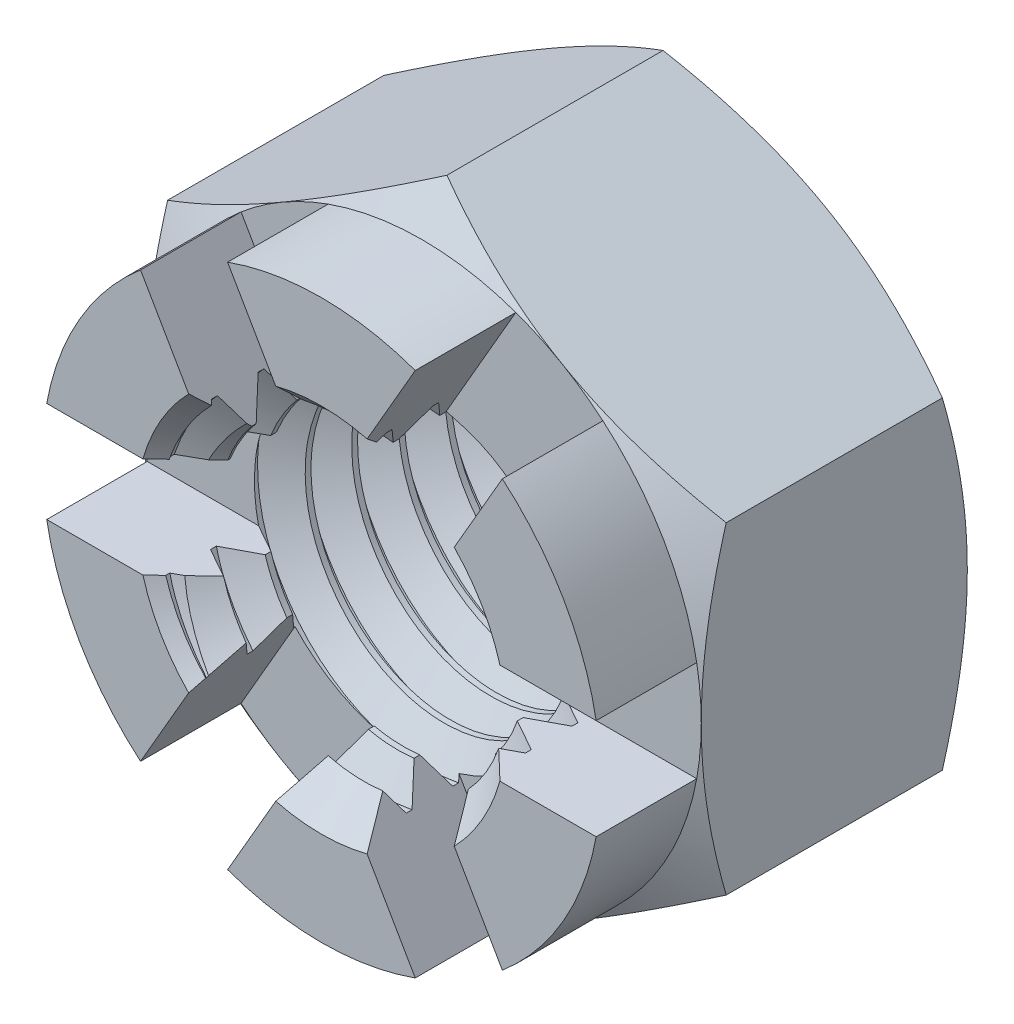
from build123d import *

# Parameters (mm, degrees)
EXTRUDE1_DEPTH      = 8.334375
SKETCH3_OUTSIDE_W   = 66.688
SKETCH3_OUTSIDE_H   = 68.652
SKETCH3_OUTSIDE_R   = 6.35
CUT_EXTRUDE2_DEPTH  = 13.788574587
CUT_EXTRUDE2_DRAFT  = -60
SKETCH4_R           = 3.9624
CUT_EXTRUDE3_DEPTH  = 13.788574587
SKETCH12_R          = 3.9624
SKETCH12_R_2        = 3.274992336
EXTRUDE2_DEPTH      = 8.334375
CUT_SWEEP1_PITCH    = 1.058333333
CUT_EXTRUDE8_DEPTH  = 2.286
SKETCH14_OUTSIDE_W  = 61.986
SKETCH14_OUTSIDE_H  = 63.95
SKETCH14_OUTSIDE_R  = 6.35
CUT_EXTRUDE9_DEPTH  = 12.431039965
CUT_EXTRUDE9_DRAFT  = -60
SKETCH15_OUTSIDE_W  = 18.922
SKETCH15_OUTSIDE_H  = 20.886
SKETCH15_OUTSIDE_R  = 6.35
CUT_EXTRUDE10_DEPTH = 2.286
CIRPATTERN1_COUNT   = 6


with BuildPart() as part:
    # Sketch1 → Extrude1 (new body)
    with BuildSketch(Plane.XY):
        Polygon((0, 7.332348419), (-6.35, 3.666174209), (-6.35, -3.666174209), (0, -7.332348419), (6.35, -3.666174209), (6.35, 3.666174209), align=None)
    extrude(amount=-EXTRUDE1_DEPTH)


with BuildPart() as cut_extrude2_tool:
    # Sketch3 outside → Cut-Extrude2 (with draft: the straight prism first)
    with BuildSketch(Plane(origin=(0, 0, -8.334375), x_dir=(-1, 0, 0), z_dir=(0, 0, -1))):
        Rectangle(SKETCH3_OUTSIDE_W, SKETCH3_OUTSIDE_H)
        Circle(SKETCH3_OUTSIDE_R, mode=Mode.SUBTRACT)
    extrude(amount=-CUT_EXTRUDE2_DEPTH)
    # Cut-Extrude2: the draft: its side faces are tilted about the plane it starts from
    cut_extrude2_sides = [cut_extrude2_tool.faces().sort_by_distance(p)[0] for p in [
        (0, -34.326, -1.440087706),
        (-33.344, 0, -1.440087706),
        (0, 34.326, -1.440087706),
        (33.344, 0, -1.440087706),
        (6.35, 0, -1.440087706),
    ]]
    draft(cut_extrude2_sides, Plane(origin=(0, 0, -8.334375), x_dir=(-1, 0, 0), z_dir=(0, 0, -1)), CUT_EXTRUDE2_DRAFT)


with BuildPart() as part_1:
    add(part.part)

    # Cut-Extrude2: cut by cut_extrude2_tool
    add(cut_extrude2_tool.part, mode=Mode.SUBTRACT)

    # Sketch4 → Cut-Extrude3 (cut, through all)
    with BuildSketch(Plane.XY):
        Circle(SKETCH4_R)
    extrude(amount=-CUT_EXTRUDE3_DEPTH, mode=Mode.SUBTRACT)

    # Sketch12 → Extrude2 (add)
    with BuildSketch(Plane.XY):
        Circle(SKETCH12_R)
        Circle(SKETCH12_R_2, mode=Mode.SUBTRACT)
    extrude(amount=-EXTRUDE2_DEPTH)

    # Cut-Sweep1: the profile of Sketch9 profile screwed along a right-hand helix of 8.875 turns, 6 arcs to a turn; built about Z, then put on its axis
    cut_sweep1_z = Axis((0, 0, 0), (0, 0, 1))
    cut_sweep1_corners = [(3.9624, 0, -0.529166667), (3.9624, 0, -0.396875), (3.274692336, 0, 0.000173205), (3.274692336, 0, -0.926214872)]
    with BuildLine(mode=Mode.PRIVATE) as cut_sweep1_profile:
        Line(cut_sweep1_corners[0], cut_sweep1_corners[1])
        Line(cut_sweep1_corners[1], cut_sweep1_corners[2])
        Line(cut_sweep1_corners[2], cut_sweep1_corners[3])
        Line(cut_sweep1_corners[3], cut_sweep1_corners[0])
    cut_sweep1_cap = Face(cut_sweep1_profile.wire())
    cut_sweep1_turn_angles = [0, 30, 60, 90, 120, 150, 180, 210, 240, 270, 300, 330, 360]
    cut_sweep1_turn_weights = [1, 0.8660254037844387, 1, 0.8660254037844387, 1, 0.8660254037844387, 1, 0.8660254037844387, 1, 0.8660254037844387, 1, 0.8660254037844387, 1]
    cut_sweep1_turn_rails = [Edge.make_bspline([Vector(p[0], p[1], 0).rotate(cut_sweep1_z, cut_sweep1_turn_angles[k]) / cut_sweep1_turn_weights[k] + Vector(0, 0, p[2] + CUT_SWEEP1_PITCH * cut_sweep1_turn_angles[k] / 360) for k in range(13)], [0, 0, 0, 1, 1, 2, 2, 3, 3, 4, 4, 5, 5, 6, 6, 6], 2, cut_sweep1_turn_weights) for p in cut_sweep1_corners]
    cut_sweep1_turn_sides = [Face.make_surface_from_curves(cut_sweep1_turn_rails[p[0]], cut_sweep1_turn_rails[p[1]]) for p in [(0, 1), (1, 2), (2, 3), (3, 0)]]
    cut_sweep1_last_angles = [2880, 2910, 2940, 2970, 3000, 3030, 3060, 3090, 3120, 3150, 3180, 3187.5, 3195]
    cut_sweep1_last_weights = [1, 0.8660254037844387, 1, 0.8660254037844387, 1, 0.8660254037844387, 1, 0.8660254037844387, 1, 0.8660254037844387, 1, 0.991444861373798, 1]
    cut_sweep1_last_rails = [Edge.make_bspline([Vector(p[0], p[1], 0).rotate(cut_sweep1_z, cut_sweep1_last_angles[k]) / cut_sweep1_last_weights[k] + Vector(0, 0, p[2] + CUT_SWEEP1_PITCH * cut_sweep1_last_angles[k] / 360) for k in range(13)], [0, 0, 0, 1, 1, 2, 2, 3, 3, 4, 4, 5, 5, 6, 6, 6], 2, cut_sweep1_last_weights) for p in cut_sweep1_corners]
    cut_sweep1_last_sides = [Face.make_surface_from_curves(cut_sweep1_last_rails[p[0]], cut_sweep1_last_rails[p[1]]) for p in [(0, 1), (1, 2), (2, 3), (3, 0)]]
    cut_sweep1 = Plane(origin=(0, 0, 0), x_dir=(0, 1, 0), z_dir=(0, 0, -1)) * Solid(Shell([*[p.moved(Location((0, 0, CUT_SWEEP1_PITCH * i))) for i in range(8) for p in cut_sweep1_turn_sides], *cut_sweep1_last_sides, cut_sweep1_cap, cut_sweep1_cap.rotate(cut_sweep1_z, 3195).moved(Location((0, 0, CUT_SWEEP1_PITCH * 3195 / 360)))]))
    add(cut_sweep1, mode=Mode.SUBTRACT)

    # Cut-Extrude6 cone 1 section (through the dimple's axis) → Cut-Extrude6 (revolve, cut)
    with BuildSketch(Plane(origin=(0, 0, 0), x_dir=(0, -1, 0), z_dir=(1, 0, 0))):
        Polygon((0, 0), (4.2164, 0), (0, 4.2164), align=None)
    revolve(axis=Axis((0, 0, 0), (0, 0, -1)), mode=Mode.SUBTRACT)

    # Cut-Extrude7 cone 1 section (through the dimple's axis) → Cut-Extrude7 (revolve, cut)
    with BuildSketch(Plane(origin=(0, 0, -8.334375), x_dir=(0, 1, 0), z_dir=(1, 0, 0))):
        Polygon((0, 0), (4.2164, 0), (0, 4.2164), align=None)
    revolve(axis=Axis((0, 0, -8.334375), (0, 0, 1)), mode=Mode.SUBTRACT)

    # Sketch13 → Cut-Extrude8 (cut)
    with BuildSketch(Plane.XY):
        Polygon((-0.989867037, 0.5715), (0.989867037, -0.5715), (4.164867037, 4.927761314), (2.185132963, 6.070761314), align=None)
    cut_extrude8 = extrude(amount=-CUT_EXTRUDE8_DEPTH, mode=Mode.SUBTRACT)


with BuildPart() as cut_extrude9_tool:
    # Sketch14 outside → Cut-Extrude9 (with draft: the straight prism first)
    with BuildSketch(Plane.XY.offset(-2.286)):
        Rectangle(SKETCH14_OUTSIDE_W, SKETCH14_OUTSIDE_H)
        Circle(SKETCH14_OUTSIDE_R, mode=Mode.SUBTRACT)
    extrude(amount=-CUT_EXTRUDE9_DEPTH)
    # Cut-Extrude9: the draft: its side faces are tilted about the plane it starts from
    cut_extrude9_sides = [cut_extrude9_tool.faces().sort_by_distance(p)[0] for p in [
        (0, -31.975, -8.501519983),
        (30.993, 0, -8.501519983),
        (0, 31.975, -8.501519983),
        (-30.993, 0, -8.501519983),
        (-6.35, 0, -8.501519983),
    ]]
    draft(cut_extrude9_sides, Plane.XY.offset(-2.286), CUT_EXTRUDE9_DRAFT)


with BuildPart() as part_2:
    add(part_1.part)

    # Cut-Extrude9: cut by cut_extrude9_tool
    add(cut_extrude9_tool.part, mode=Mode.SUBTRACT)

    # Sketch15 outside → Cut-Extrude10 (cut)
    with BuildSketch(Plane.XY):
        Rectangle(SKETCH15_OUTSIDE_W, SKETCH15_OUTSIDE_H)
        Circle(SKETCH15_OUTSIDE_R, mode=Mode.SUBTRACT)
    extrude(amount=-CUT_EXTRUDE10_DEPTH, mode=Mode.SUBTRACT)

    # CirPattern1: Cut-Extrude8 ×6 about axis
    cirpattern1_axis = Axis((0, 0, 0), (0, 0, 1))
    for i in range(1, CIRPATTERN1_COUNT):
        add(cut_extrude8.rotate(cirpattern1_axis, i * 360 / CIRPATTERN1_COUNT), mode=Mode.SUBTRACT)


solid = part_2.part
